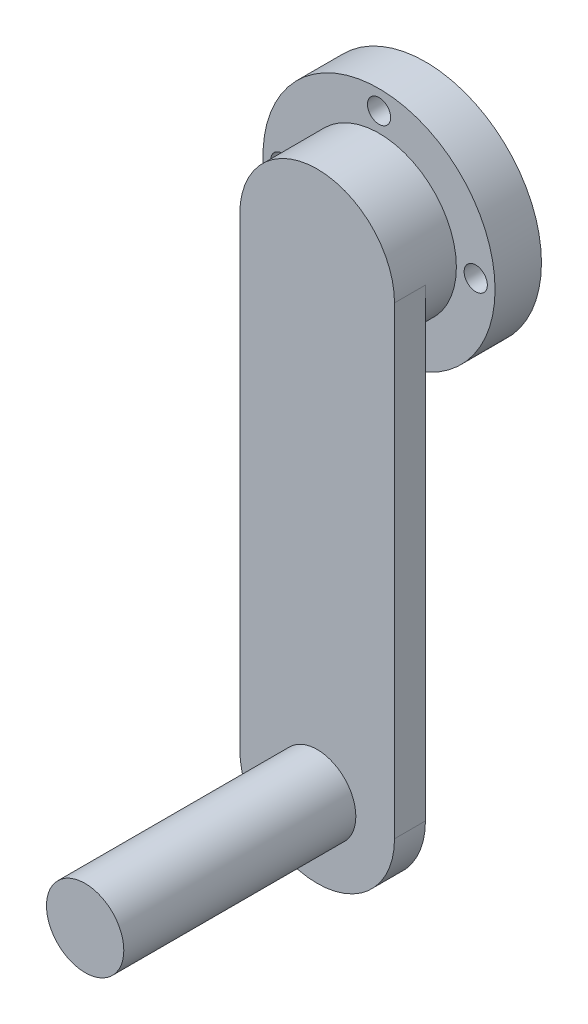
from build123d import *
from build123d.topology import SkipClean

# Parameters (mm, degrees)
SKETCH1_R           = 15
SKETCH1_R_2         = 1.5
BOSS_EXTRUDE1_DEPTH = 6
SKETCH2_R           = 10
BOSS_EXTRUDE2_DEPTH = 4
BOSS_EXTRUDE3_DEPTH = 4
SKETCH5_R           = 5
BOSS_EXTRUDE4_DEPTH = 30


with BuildPart() as part:
    # Sketch1 → Boss-Extrude1 (new body)
    with BuildSketch(Plane.XY):
        Circle(SKETCH1_R)
        with Locations((0, 12.5)):
            Circle(SKETCH1_R_2, mode=Mode.SUBTRACT)
        with Locations((12.5, 0)):
            Circle(SKETCH1_R_2, mode=Mode.SUBTRACT)
        with Locations((0, -12.5)):
            Circle(SKETCH1_R_2, mode=Mode.SUBTRACT)
        with Locations((-12.5, 0)):
            Circle(SKETCH1_R_2, mode=Mode.SUBTRACT)
    extrude(amount=BOSS_EXTRUDE1_DEPTH)

    # Sketch2 → Boss-Extrude2 (add)
    with BuildSketch(Plane.XY.offset(6)):
        Circle(SKETCH2_R)
    extrude(amount=BOSS_EXTRUDE2_DEPTH)

    # Sketch4 → Boss-Extrude3 (add)
    with SkipClean():  # the faces are left unmerged after this step: merging them gives an invalid solid
        with BuildSketch(Plane.XY.offset(10)):
            with BuildLine():
                Line((-10, -60), (-10, 0))
                ThreePointArc((-10, 0), (0, 10), (10, 0))
                Line((10, 0), (10, -60))
                ThreePointArc((10, -60), (0, -70), (-10, -60))
            make_face()
        extrude(amount=BOSS_EXTRUDE3_DEPTH)
    add(part.part.scale(1), mode=Mode.REPLACE)  # the faces are merged on a copy

    # Sketch5 → Boss-Extrude4 (add)
    with BuildSketch(Plane.XY.offset(14)):
        with Locations((0, -60)):
            Circle(SKETCH5_R)
    extrude(amount=BOSS_EXTRUDE4_DEPTH)


solid = part.part
